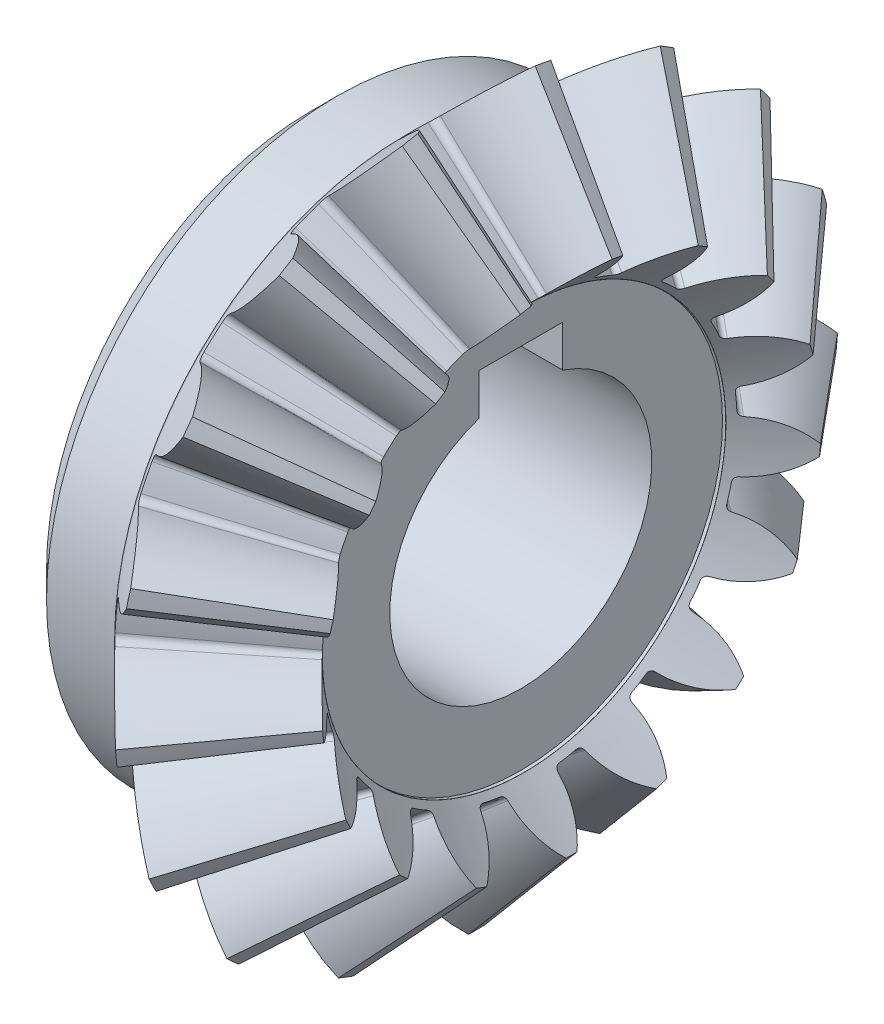
from build123d import *

# Parameters (mm, degrees)
TEETHCUTS_COUNT     = 17
TEETHCUTS_ANGLE     = 338.823529412
HUBSKE_R            = 27.936415229
HUB_DEPTH           = 9.186516829
BORSKE_R            = 12.5
BORE_DEPTH          = 45.0000508
KEYSKE_W            = 8
KEYSKE_H            = 15.8
KEYWAY_DEPTH        = 45.0000508
SKETCH_2_R          = 19.25
CUT_EXTRUDE_2_DEPTH = 0.309227445
CHAMFER_1_SIZE      = 2.5


with BuildPart() as part:
    # BasProSke → Base-Revolve (revolve)
    with BuildSketch(Plane(origin=(0, 0, 0), x_dir=(1, 0, 0), z_dir=(0, 1, 0)), mode=Mode.PRIVATE) as base_revolve_sk:
        Polygon((0, 0), (0, 27.936415232), (6.590235207, 34.526650427), (15.666200721, 23.80362607), (11.122710616, 19.260135973), (11.122710616, 0), align=None)
    revolve(base_revolve_sk.sketch.rotate(Axis((-10, 0, 0), (1, 0, 0)), 180), axis=Axis((-10, 0, 0), (1, 0, 0)))

    # ToothCut: read off the stored shape, not the designer's step
    # ToothCut: loft between two sections, ruled curve by curve
    toothcut_from = [
        Edge.make_bspline([(35.819453128, 0.005868353, -0.00961323), (35.815289048, 0.001704273, -0.014697142), (35.809816323, -0.003768452, -0.013907309), (35.806464238, -0.007120537, -0.007738651)], [0, 0, 0, 0, 1, 1, 1, 1], 3, [1, 0.791128662, 0.791128662, 1]),
        Edge.make_bspline([(35.806464238, -0.007120537, 0.007738651), (35.809816323, -0.003768452, 0.013907309), (35.815289048, 0.001704273, 0.014697142), (35.819453128, 0.005868353, 0.00961323)], [0, 0, 0, 0, 1, 1, 1, 1], 3, [1, 0.791128662, 0.791128662, 1]),
        Edge.make_bspline([(35.806464238, -0.007120537, -0.007738651), (35.805933476, -0.007651299, -0.006761919), (35.805508065, -0.00807671, -0.00568699), (35.805196931, -0.008387844, -0.004536419)], [0, 0, 0, 0, 1, 1, 1, 1], 3, [1, 0.993005641, 0.993005641, 1]),
        Edge.make_bspline([(35.805196931, -0.008387844, 0.004536419), (35.805508065, -0.00807671, 0.00568699), (35.805933476, -0.007651299, 0.006761919), (35.806464238, -0.007120537, 0.007738651)], [0, 0, 0, 0, 1, 1, 1, 1], 3, [1, 0.993005641, 0.993005641, 1]),
        Edge.make_bspline([(35.805196931, -0.008387844, -0.004536419), (35.804397925, -0.00918685, -0.001581705), (35.804397925, -0.00918685, 0.001581705), (35.805196931, -0.008387844, 0.004536419)], [0, 0, 0, 0, 1, 1, 1, 1], 3, [1, 0.956019035, 0.956019035, 1]),
        Edge.make_line((35.819453128, 0.005868353, 0.00961323), (35.819453128, 0.005868353, -0.00961323)),
    ]
    toothcut_to = [
        Edge.make_bspline([(6.721419176, 34.657834396, -6.166069229), (5.285380522, 33.221795745, -3.831202861), (3.363642215, 31.300057442, -2.351385725), (1.197608706, 29.134023936, -1.912509128)], [0, 0, 0, 0, 1, 1, 1, 1], 3, [1, 0.958127415, 0.958127415, 1]),
        Edge.make_bspline([(1.197608706, 29.134023936, 1.912509128), (3.363642215, 31.300057442, 2.351385725), (5.285380522, 33.221795745, 3.831202861), (6.721419176, 34.657834396, 6.166069229)], [0, 0, 0, 0, 1, 1, 1, 1], 3, [1, 0.958127415, 0.958127415, 1]),
        Edge.make_bspline([(1.197608706, 29.134023936, -1.912509128), (0.930392579, 28.866807809, -1.858366427), (0.758008766, 28.694423997, -1.564584209), (0.769657379, 28.70607261, -1.183180265)], [0, 0, 0, 0, 1, 1, 1, 1], 3, [1, 0.82751646, 0.82751646, 1]),
        Edge.make_bspline([(0.769657379, 28.70607261, 1.183180265), (0.758008766, 28.694423997, 1.564584209), (0.930392579, 28.866807809, 1.858366427), (1.197608706, 29.134023936, 1.912509128)], [0, 0, 0, 0, 1, 1, 1, 1], 3, [1, 0.82751646, 0.82751646, 1]),
        Edge.make_bspline([(0.769657379, 28.70607261, -1.183180265), (0.793740554, 28.730155785, -0.394638485), (0.793740554, 28.730155785, 0.394638485), (0.769657379, 28.70607261, 1.183180265)], [0, 0, 0, 0, 1, 1, 1, 1], 3, [1, 0.999379017, 0.999379017, 1]),
        Edge.make_line((6.721419176, 34.657834396, 6.166069229), (6.721419176, 34.657834396, -6.166069229)),
    ]
    toothcut = Solid(Shell([*[Face.make_surface_from_curves(toothcut_from[k], toothcut_to[k]) for k in range(6)], Face(Wire(toothcut_from)), Face(Wire(toothcut_to))]))
    add(toothcut, mode=Mode.SUBTRACT)

    # TeethCuts: ToothCut ×17 about axis
    teethcuts_axis = Axis((-10, 0, 0), (1, 0, 0))
    for i in range(1, TEETHCUTS_COUNT):
        add(toothcut.rotate(teethcuts_axis, i * TEETHCUTS_ANGLE / (TEETHCUTS_COUNT - 1)), mode=Mode.SUBTRACT)

    # HubSke → Hub (add)
    with BuildSketch(Plane.ZY):
        Circle(HUBSKE_R)
    extrude(amount=HUB_DEPTH)

    # BorSke → Bore (cut, symmetric)
    with BuildSketch(Plane(origin=(0, 0, 0), x_dir=(0, 0, -1), z_dir=(1, 0, 0))):
        with Locations(Location((0, 0, 0), (0, 0, 180))):
            Circle(BORSKE_R)
    extrude(amount=BORE_DEPTH, both=True, mode=Mode.SUBTRACT)

    # KeySke → Keyway (cut, symmetric)
    with BuildSketch(Plane(origin=(0, 0, 0), x_dir=(0, 0, -1), z_dir=(1, 0, 0))):
        with Locations((0, 7.9)):
            Rectangle(KEYSKE_W, KEYSKE_H)
    extrude(amount=KEYWAY_DEPTH, both=True, mode=Mode.SUBTRACT)

    # Эскиз11 → Вырез-Повернуть1 (revolve, cut)
    with BuildSketch(Plane(origin=(0, 0, 0), x_dir=(1, 0, 0), z_dir=(0, 1, 0))):
        Polygon((-0.186415233, 27.75), (0, 27.936415229), (-9.186516829, 27.936415229), (-9.186516829, 27.75), align=None)
    revolve(axis=Axis((0, 0, 0), (-1, 0, 0)), mode=Mode.SUBTRACT)

    # Эскиз2 → Вытянуть2 (cut)
    with BuildSketch(Plane(origin=(11.122710616, 0, 0), x_dir=(0, 0, -1), z_dir=(1, 0, 0))):
        Circle(SKETCH_2_R)
    extrude(amount=-CUT_EXTRUDE_2_DEPTH, mode=Mode.SUBTRACT)

    # Фаска1
    chamfer_1_edges = [part.edges().sort_by_distance(p)[0] for p in [
        (-9.186516829, 0, 27.75),
    ]]
    chamfer(chamfer_1_edges, length=CHAMFER_1_SIZE)


solid = part.part
